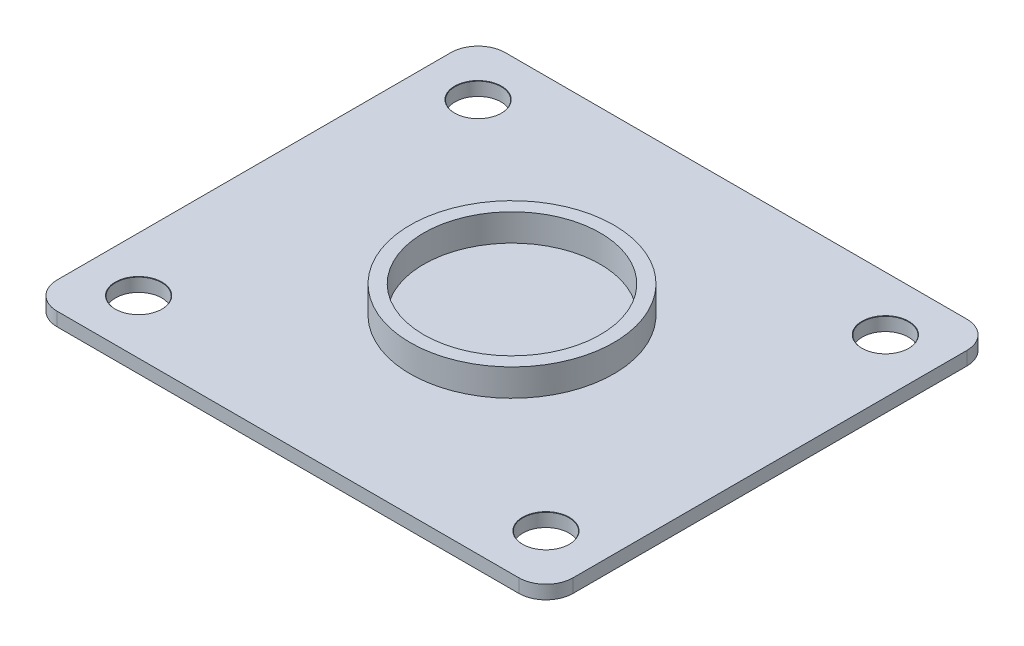
from build123d import *

# Parameters (mm, degrees)
SKETCH1_W                     = 38
SKETCH1_H                     = 33
BOSS_EXTRUDE1_DEPTH           = 1
SKETCH2_R                     = 7.5
SKETCH2_R_2                   = 6.5
BOSS_EXTRUDE2_DEPTH           = 2
M3_CLEARANCE_HOLE1_AT_2_COUNT = 2
M3_CLEARANCE_HOLE1_AT_2_PITCH = 25
M3_CLEARANCE_HOLE1_AT_3_COUNT = 2
M3_CLEARANCE_HOLE1_AT_3_PITCH = 39.05124838
M3_CLEARANCE_HOLE1_AT_4_COUNT = 2
M3_CLEARANCE_HOLE1_AT_4_PITCH = 30
FILLET1_R                     = 2


with BuildPart() as part:
    # Sketch1 → Boss-Extrude1 (new body)
    with BuildSketch(Plane(origin=(0, 0, 0), x_dir=(1, 0, 0), z_dir=(0, 1, 0))):
        with Locations((19, 16.5)):
            Rectangle(SKETCH1_W, SKETCH1_H)
    extrude(amount=BOSS_EXTRUDE1_DEPTH)

    # Sketch2 → Boss-Extrude2 (add)
    with BuildSketch(Plane(origin=(0, 1, 0), x_dir=(1, 0, 0), z_dir=(0, 1, 0))):
        with Locations((19, 16.5)):
            Circle(SKETCH2_R)
        with Locations((19, 16.5)):
            Circle(SKETCH2_R_2, mode=Mode.SUBTRACT)
    extrude(amount=BOSS_EXTRUDE2_DEPTH)

    # Sketch4 → M3 Clearance Hole1 (revolve, cut)
    with BuildSketch(Plane(origin=(4, 1, -4), x_dir=(0, 0, 1), z_dir=(1, 0, 0))):
        Polygon((0, 0), (0, 1), (1.7, 1), (1.7, 0.025), (1.725, 0), align=None)
    m3_clearance_hole1 = revolve(axis=Axis((4, 7.35, -4), (0, -1, 0)), mode=Mode.SUBTRACT)

    # M3 Clearance Hole1 at 2: M3 Clearance Hole1 ×2
    with Locations(*[(0, 0, -i * M3_CLEARANCE_HOLE1_AT_2_PITCH) for i in range(1, M3_CLEARANCE_HOLE1_AT_2_COUNT)]):
        add(m3_clearance_hole1, mode=Mode.SUBTRACT)

    # M3 Clearance Hole1 at 3: M3 Clearance Hole1 ×2
    with Locations(*[Vector(0.768221279597376, 0, -0.6401843996644799) * (i * M3_CLEARANCE_HOLE1_AT_3_PITCH) for i in range(1, M3_CLEARANCE_HOLE1_AT_3_COUNT)]):
        add(m3_clearance_hole1, mode=Mode.SUBTRACT)

    # M3 Clearance Hole1 at 4: M3 Clearance Hole1 ×2
    with Locations(*[(i * M3_CLEARANCE_HOLE1_AT_4_PITCH, 0, 0) for i in range(1, M3_CLEARANCE_HOLE1_AT_4_COUNT)]):
        add(m3_clearance_hole1, mode=Mode.SUBTRACT)

    # Fillet1
    fillet1_edges = [part.edges().sort_by_distance(p)[0] for p in [
        (0, 0.5, -33),
        (38, 0.5, -33),
        (38, 0.5, 0),
        (0, 0.5, 0),
    ]]
    fillet(fillet1_edges, radius=FILLET1_R)


solid = part.part
